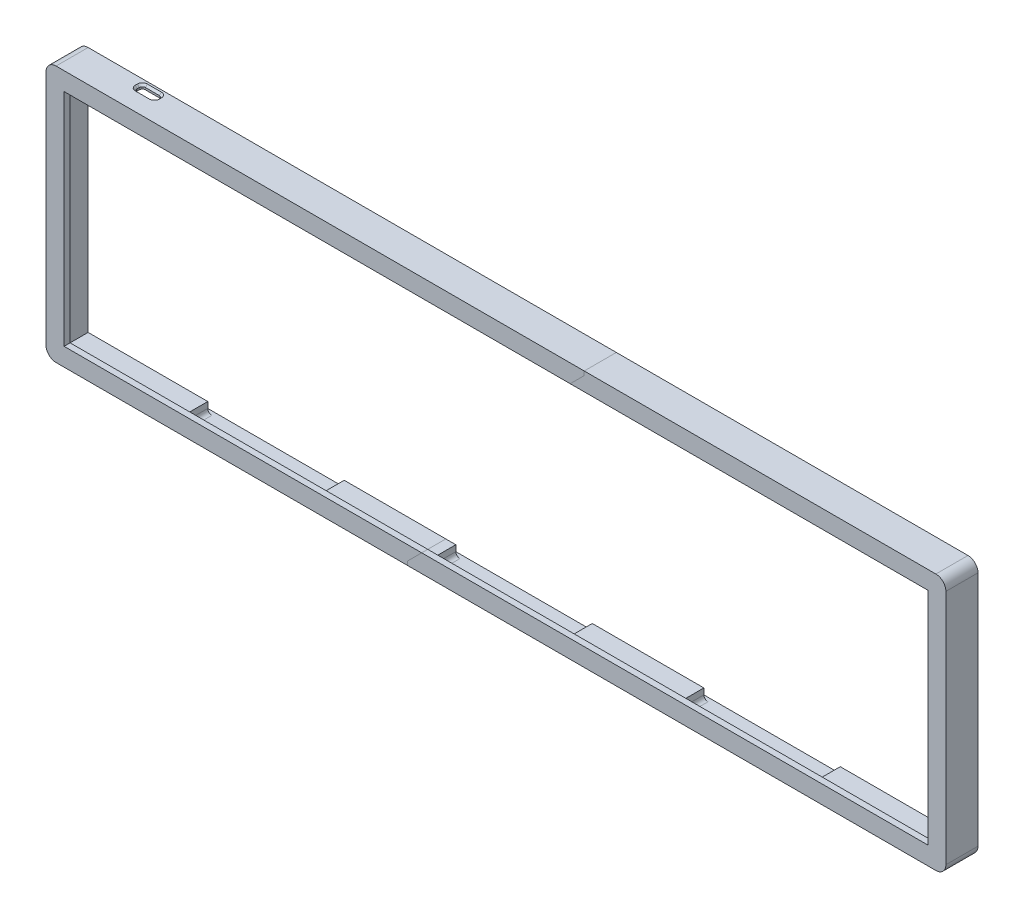
from build123d import *

# Parameters (mm, degrees)
BOSS_EXTRUDE1_DEPTH = 16
SKETCH2_W           = 438.581
SKETCH2_H           = 128
SKETCH2_W_2         = 430.581
SKETCH2_H_2         = 110
BOSS_EXTRUDE2_DEPTH = 3
SKETCH3_W           = 440.5822769
SKETCH3_H           = 124
CUT_EXTRUDE1_DEPTH  = 2
SKETCH4_R           = 1.05
CUT_EXTRUDE2_DEPTH  = 2.5
SKETCH5_W           = 30
SKETCH5_H           = 5
CUT_EXTRUDE3_DEPTH  = 6
CUT_EXTRUDE4_DEPTH  = 4
CHAMFER8_SIZE       = 1
SPLIT1_DEPTH        = 16
SPLIT1_START        = 2
SPLIT1_2_OUTLINE_R  = 1.05
SPLIT1_2_DEPTH      = 14
SPLIT1_START_2      = 13
SPLIT1_3_OUTLINE_R  = 1.05
SPLIT1_3_DEPTH      = 3
SPLIT1_4_DEPTH      = 3.5
SPLIT1_START_3      = 8
SPLIT1_5_OUTLINE_R  = 1.05
SPLIT1_5_DEPTH      = 5
SPLIT1_START_4      = 4.5
SPLIT1_6_OUTLINE_R  = 1.05
SPLIT1_6_DEPTH      = 3.5
SPLIT1_START_5      = 118
SPLIT1_7_DEPTH      = 4


with BuildPart() as part:
    # Sketch1 → Boss-Extrude1 (new body)
    with BuildSketch(Plane.XY):
        with BuildLine():
            ThreePointArc((-7, -2), (-5.535533906, -5.535533906), (-2, -7))
            Line((-2, -7), (436.581, -7))
            ThreePointArc((436.581, -7), (440.116533906, -5.535533906), (441.581, -2))
            Line((441.581, -2), (441.581, 116))
            ThreePointArc((441.581, 116), (440.116533906, 119.535533906), (436.581, 121))
            Line((436.581, 121), (-2, 121))
            ThreePointArc((-2, 121), (-5.535533906, 119.535533906), (-7, 116))
            Line((-7, 116), (-7, -2))
        make_face()
        with BuildLine():
            Line((251.291, 114), (306.936, 114))
            Line((306.936, 114), (306.936, 117))
            ThreePointArc((306.936, 117), (307.521786438, 118.414213562), (308.936, 119))
            Line((308.936, 119), (372.936, 119))
            ThreePointArc((372.936, 119), (374.350213562, 118.414213562), (374.936, 117))
            Line((374.936, 117), (374.936, 114))
            Line((374.936, 114), (434.581, 114))
            Line((434.581, 114), (434.581, 0))
            Line((434.581, 0), (374.936, 0))
            Line((374.936, 0), (374.936, -3))
            ThreePointArc((374.936, -3), (374.350213562, -4.414213562), (372.936, -5))
            Line((372.936, -5), (308.936, -5))
            ThreePointArc((308.936, -5), (307.521786438, -4.414213562), (306.936, -3))
            Line((306.936, -3), (306.936, 0))
            Line((306.936, 0), (251.291, 0))
            Line((251.291, 0), (251.291, -3))
            ThreePointArc((251.291, -3), (250.705213562, -4.414213562), (249.291, -5))
            Line((249.291, -5), (185.291, -5))
            ThreePointArc((185.291, -5), (183.876786438, -4.414213562), (183.291, -3))
            Line((183.291, -3), (183.291, 0))
            Line((183.291, 0), (127.646, 0))
            Line((127.646, 0), (127.646, -3))
            ThreePointArc((127.646, -3), (127.060213562, -4.414213562), (125.646, -5))
            Line((125.646, -5), (61.646, -5))
            ThreePointArc((61.646, -5), (60.231786438, -4.414213562), (59.646, -3))
            Line((59.646, -3), (59.646, 0))
            Line((59.646, 0), (0, 0))
            Line((0, 0), (0, 114))
            Line((0, 114), (59.646, 114))
            Line((59.646, 114), (59.646, 117))
            ThreePointArc((59.646, 117), (60.231786438, 118.414213562), (61.646, 119))
            Line((61.646, 119), (125.646, 119))
            ThreePointArc((125.646, 119), (127.060213562, 118.414213562), (127.646, 117))
            Line((127.646, 117), (127.646, 114))
            Line((127.646, 114), (183.291, 114))
            Line((183.291, 114), (183.291, 117))
            ThreePointArc((183.291, 117), (183.876786438, 118.414213562), (185.291, 119))
            Line((185.291, 119), (249.291, 119))
            ThreePointArc((249.291, 119), (250.705213562, 118.414213562), (251.291, 117))
            Line((251.291, 117), (251.291, 114))
        make_face(mode=Mode.SUBTRACT)
    extrude(amount=BOSS_EXTRUDE1_DEPTH)

    # Sketch2 → Boss-Extrude2 (add)
    with BuildSketch(Plane.XY.offset(16)):
        with Locations((217.2905, 57)):
            Rectangle(SKETCH2_W, SKETCH2_H)
        with Locations((217.2905, 57)):
            Rectangle(SKETCH2_W_2, SKETCH2_H_2, mode=Mode.SUBTRACT)
    extrude(amount=-BOSS_EXTRUDE2_DEPTH)

    # Sketch3 → Cut-Extrude1 (cut)
    with BuildSketch(Plane(origin=(0, 0, 0), x_dir=(-1, 0, 0), z_dir=(0, 0, -1))):
        with Locations((-217.28986155, 57)):
            Rectangle(SKETCH3_W, SKETCH3_H)
    extrude(amount=-CUT_EXTRUDE1_DEPTH, mode=Mode.SUBTRACT)

    # Sketch4 → Cut-Extrude2 (cut)
    with BuildSketch(Plane(origin=(0, 0, 2), x_dir=(-1, 0, 0), z_dir=(0, 0, -1))):
        with Locations((-279.1135, 116.5)):
            Circle(SKETCH4_R)
        with Locations((-155.4685, 116.5)):
            Circle(SKETCH4_R)
        with Locations((-279.1135, -2.5)):
            Circle(SKETCH4_R)
        with Locations((-155.4685, -2.5)):
            Circle(SKETCH4_R)
        with Locations((-2, -2.5)):
            Circle(SKETCH4_R)
        with Locations((-2, 116.5)):
            Circle(SKETCH4_R)
        with Locations((-432.581, 116.5)):
            Circle(SKETCH4_R)
        with Locations((-432.581, -2.5)):
            Circle(SKETCH4_R)
    extrude(amount=-CUT_EXTRUDE2_DEPTH, mode=Mode.SUBTRACT)

    # Sketch5 → Cut-Extrude3 (cut)
    with BuildSketch(Plane(origin=(0, 0, 2), x_dir=(-1, 0, 0), z_dir=(0, 0, -1))):
        with Locations((-32, 116.5)):
            Rectangle(SKETCH5_W, SKETCH5_H)
    extrude(amount=-CUT_EXTRUDE3_DEPTH, mode=Mode.SUBTRACT)

    # Sketch6 → Cut-Extrude4 (cut)
    with BuildSketch(Plane.XZ.offset(-119)):
        with BuildLine():
            Line((35.52, 2), (28.52, 2))
            ThreePointArc((28.52, 2), (27.459339828, 2.439339828), (27.02, 3.5))
            Line((27.02, 3.5), (27.02, 4.5))
            ThreePointArc((27.02, 4.5), (27.459339828, 5.560660172), (28.52, 6))
            Line((28.52, 6), (35.52, 6))
            ThreePointArc((35.52, 6), (36.580660172, 5.560660172), (37.02, 4.5))
            Line((37.02, 4.5), (37.02, 3.5))
            ThreePointArc((37.02, 3.5), (36.580660172, 2.439339828), (35.52, 2))
        make_face()
    extrude(amount=-CUT_EXTRUDE4_DEPTH, mode=Mode.SUBTRACT)

    # Chamfer8
    chamfer8_edges = [part.edges().sort_by_distance(p)[0] for p in [
        (32.02, 121, 6),
        (27.459339828, 121, 5.560660172),
        (27.02, 121, 4),
        (27.459339828, 121, 2.439339828),
        (32.02, 121, 2),
        (36.580660172, 121, 2.439339828),
        (37.02, 121, 4),
        (36.580660172, 121, 5.560660172),
    ]]
    chamfer(chamfer8_edges, length=CHAMFER8_SIZE)

    # Split1: read off the stored shape, not the designer's step
    # Split1 outline → Split1 (cut)
    with BuildSketch(Plane.XY):
        with BuildLine():
            Line((261.291, 121), (-2, 121))
            ThreePointArc((-2, 121), (-5.535533906, 119.535533906), (-7, 116))
            Line((-7, 116), (-7, -2))
            ThreePointArc((-7, -2), (-5.535533906, -5.535533906), (-2, -7))
            Line((-2, -7), (173.291, -7))
            Line((173.291, -7), (173.291, -5))
            Line((173.291, -5), (180.291, 2))
            Line((180.291, 2), (2, 2))
            Line((2, 2), (2, 112))
            Line((2, 112), (254.291, 112))
            Line((254.291, 112), (261.291, 119))
            Line((261.291, 119), (261.291, 121))
        make_face()
    extrude(amount=SPLIT1_DEPTH, mode=Mode.SUBTRACT)


with BuildPart() as body_2:
    # Split1 2 outline → Split1 2 (new body)
    # profile 1 of 2: a face of its own
    with BuildSketch(Plane.XY.offset(SPLIT1_START)):
        with BuildLine():
            ThreePointArc((127.646, -3), (127.060213562, -4.414213562), (125.646, -5))
            Line((125.646, -5), (61.646, -5))
            ThreePointArc((61.646, -5), (60.231786438, -4.414213562), (59.646, -3))
            Line((59.646, -3), (59.646, 0))
            Line((59.646, 0), (0, 0))
            Line((0, 0), (0, 114))
            Line((0, 114), (17, 114))
            Line((17, 114), (17, 119))
            Line((17, 119), (27.02, 119))
            Line((27.02, 119), (27.02, 120))
            Line((27.02, 120), (26.02, 121))
            Line((26.02, 121), (-2, 121))
            ThreePointArc((-2, 121), (-5.535533906, 119.535533906), (-7, 116))
            Line((-7, 116), (-7, -2))
            ThreePointArc((-7, -2), (-5.535533906, -5.535533906), (-2, -7))
            Line((-2, -7), (173.291, -7))
            Line((173.291, -7), (173.291, -5))
            Line((173.291, -5), (178.291, 0))
            Line((178.291, 0), (127.646, 0))
            Line((127.646, 0), (127.646, -3))
        make_face()
        with Locations((155.4685, -2.5)):
            Circle(SPLIT1_2_OUTLINE_R, mode=Mode.SUBTRACT)
        with Locations((2, -2.5)):
            Circle(SPLIT1_2_OUTLINE_R, mode=Mode.SUBTRACT)
        with Locations((2, 116.5)):
            Circle(SPLIT1_2_OUTLINE_R, mode=Mode.SUBTRACT)
    # profile 2 of 2: a face of its own
    with BuildSketch(Plane.XY.offset(SPLIT1_START)):
        with BuildLine():
            Line((251.291, 114), (256.291, 114))
            Line((256.291, 114), (261.291, 119))
            Line((261.291, 119), (261.291, 121))
            Line((261.291, 121), (38.02, 121))
            Line((38.02, 121), (37.02, 120))
            Line((37.02, 120), (37.02, 119))
            Line((37.02, 119), (47, 119))
            Line((47, 119), (47, 114))
            Line((47, 114), (59.646, 114))
            Line((59.646, 114), (59.646, 117))
            ThreePointArc((59.646, 117), (60.231786438, 118.414213562), (61.646, 119))
            Line((61.646, 119), (125.646, 119))
            ThreePointArc((125.646, 119), (127.060213562, 118.414213562), (127.646, 117))
            Line((127.646, 117), (127.646, 114))
            Line((127.646, 114), (183.291, 114))
            Line((183.291, 114), (183.291, 117))
            ThreePointArc((183.291, 117), (183.876786438, 118.414213562), (185.291, 119))
            Line((185.291, 119), (249.291, 119))
            ThreePointArc((249.291, 119), (250.705213562, 118.414213562), (251.291, 117))
            Line((251.291, 117), (251.291, 114))
        make_face()
        with Locations((155.4685, 116.5)):
            Circle(SPLIT1_2_OUTLINE_R, mode=Mode.SUBTRACT)
    extrude(amount=SPLIT1_2_DEPTH)

    # Split1 3 outline → Split1 3 (add)
    with BuildSketch(Plane.XY.offset(SPLIT1_START_2)):
        with BuildLine():
            Line((127.646, 0), (178.291, 0))
            Line((178.291, 0), (180.291, 2))
            Line((180.291, 2), (2, 2))
            Line((2, 2), (2, 112))
            Line((2, 112), (254.291, 112))
            Line((254.291, 112), (256.291, 114))
            Line((256.291, 114), (251.291, 114))
            Line((251.291, 114), (251.291, 117))
            ThreePointArc((251.291, 117), (250.705213562, 118.414213562), (249.291, 119))
            Line((249.291, 119), (185.291, 119))
            ThreePointArc((185.291, 119), (183.876786438, 118.414213562), (183.291, 117))
            Line((183.291, 117), (183.291, 114))
            Line((183.291, 114), (127.646, 114))
            Line((127.646, 114), (127.646, 117))
            ThreePointArc((127.646, 117), (127.060213562, 118.414213562), (125.646, 119))
            Line((125.646, 119), (61.646, 119))
            ThreePointArc((61.646, 119), (60.231786438, 118.414213562), (59.646, 117))
            Line((59.646, 117), (59.646, 114))
            Line((59.646, 114), (47, 114))
            Line((47, 114), (47, 119))
            Line((47, 119), (37.02, 119))
            Line((37.02, 119), (37.02, 120))
            Line((37.02, 120), (38.02, 121))
            Line((38.02, 121), (26.02, 121))
            Line((26.02, 121), (27.02, 120))
            Line((27.02, 120), (27.02, 119))
            Line((27.02, 119), (17, 119))
            Line((17, 119), (17, 114))
            Line((17, 114), (0, 114))
            Line((0, 114), (0, 0))
            Line((0, 0), (59.646, 0))
            Line((59.646, 0), (59.646, -3))
            ThreePointArc((59.646, -3), (60.231786438, -4.414213562), (61.646, -5))
            Line((61.646, -5), (125.646, -5))
            ThreePointArc((125.646, -5), (127.060213562, -4.414213562), (127.646, -3))
            Line((127.646, -3), (127.646, 0))
        make_face()
        with Locations((155.4685, 116.5)):
            Circle(SPLIT1_3_OUTLINE_R)
        with Locations((2, 116.5)):
            Circle(SPLIT1_3_OUTLINE_R)
        with Locations((2, -2.5)):
            Circle(SPLIT1_3_OUTLINE_R)
        with Locations((155.4685, -2.5)):
            Circle(SPLIT1_3_OUTLINE_R)
    extrude(amount=SPLIT1_3_DEPTH)

    # Split1 4 outline → Split1 4 (add)
    with BuildSketch(Plane.XY):
        with BuildLine():
            Line((173.291, -7), (173.291, -5))
            Line((173.291, -5), (-3.0012769, -5))
            Line((-3.0012769, -5), (-3.0012769, 119))
            Line((-3.0012769, 119), (261.291, 119))
            Line((261.291, 119), (261.291, 121))
            Line((261.291, 121), (-2, 121))
            ThreePointArc((-2, 121), (-5.535533906, 119.535533906), (-7, 116))
            Line((-7, 116), (-7, -2))
            ThreePointArc((-7, -2), (-5.535533906, -5.535533906), (-2, -7))
            Line((-2, -7), (173.291, -7))
        make_face()
    extrude(amount=SPLIT1_4_DEPTH)

    # Split1 5 outline → Split1 5 (add)
    with BuildSketch(Plane.XY.offset(SPLIT1_START_3)):
        Polygon((27.02, 119), (17, 119), (17, 114), (47, 114), (47, 119), (37.02, 119), (37.02, 120), (38.02, 121), (26.02, 121), (27.02, 120), align=None)
        with Locations((155.4685, 116.5)):
            Circle(SPLIT1_5_OUTLINE_R)
        with Locations((2, 116.5)):
            Circle(SPLIT1_5_OUTLINE_R)
        with Locations((2, -2.5)):
            Circle(SPLIT1_5_OUTLINE_R)
        with Locations((155.4685, -2.5)):
            Circle(SPLIT1_5_OUTLINE_R)
    extrude(amount=SPLIT1_5_DEPTH)

    # Split1 6 outline → Split1 6 (add)
    with BuildSketch(Plane.XY.offset(SPLIT1_START_4)):
        Polygon((38.02, 121), (26.02, 121), (27.02, 120), (27.02, 119), (37.02, 119), (37.02, 120), align=None)
        with Locations((155.4685, 116.5)):
            Circle(SPLIT1_6_OUTLINE_R)
        with Locations((2, 116.5)):
            Circle(SPLIT1_6_OUTLINE_R)
        with Locations((2, -2.5)):
            Circle(SPLIT1_6_OUTLINE_R)
        with Locations((155.4685, -2.5)):
            Circle(SPLIT1_6_OUTLINE_R)
    extrude(amount=SPLIT1_6_DEPTH)

    # Split1 7 outline → Split1 7 (cut)
    with BuildSketch(Plane(origin=(0, 0, 0), x_dir=(1, 0, 0), z_dir=(0, 1, 0)).offset(SPLIT1_START_5)):
        with BuildLine():
            ThreePointArc((27.02, -4.5), (27.459339828, -5.560660172), (28.52, -6))
            Line((28.52, -6), (35.52, -6))
            ThreePointArc((35.52, -6), (36.580660172, -5.560660172), (37.02, -4.5))
            Line((37.02, -4.5), (27.02, -4.5))
        make_face()
        with BuildLine():
            ThreePointArc((28.52, -2), (27.459339828, -2.439339828), (27.02, -3.5))
            Line((27.02, -3.5), (37.02, -3.5))
            ThreePointArc((37.02, -3.5), (36.580660172, -2.439339828), (35.52, -2))
            Line((35.52, -2), (28.52, -2))
        make_face()
    extrude(amount=SPLIT1_7_DEPTH, mode=Mode.SUBTRACT)

    # Split1 8: loft between two sections, ruled curve by curve
    split1_8_from = [
        Edge.make_three_point_arc((27.02, 120, 4.5), (27.459339828, 120, 5.560660172), (28.52, 120, 6)),
        Edge.make_three_point_arc((35.52, 120, 6), (36.580660172, 120, 5.560660172), (37.02, 120, 4.5)),
        Edge.make_line((28.52, 120, 6), (35.52, 120, 6)),
        Edge.make_line((37.02, 120, 4.5), (27.02, 120, 4.5)),
    ]
    split1_8_to = [
        Edge.make_three_point_arc((26.02, 121, 4.5), (26.752233047, 121, 6.267766953), (28.52, 121, 7)),
        Edge.make_three_point_arc((35.52, 121, 7), (37.287766953, 121, 6.267766953), (38.02, 121, 4.5)),
        Edge.make_line((28.52, 121, 7), (35.52, 121, 7)),
        Edge.make_line((38.02, 121, 4.5), (26.02, 121, 4.5)),
    ]
    split1_8 = Solid(Shell([*[Face.make_surface_from_curves(split1_8_from[k], split1_8_to[k]) for k in range(4)], Face(Wire(split1_8_from)), Face(Wire(split1_8_to))]))
    add(split1_8, mode=Mode.SUBTRACT)

    # Split1 9: loft between two sections, ruled curve by curve
    split1_9_from = [
        Edge.make_three_point_arc((37.02, 120, 3.5), (36.580660172, 120, 2.439339828), (35.52, 120, 2)),
        Edge.make_three_point_arc((28.52, 120, 2), (27.459339828, 120, 2.439339828), (27.02, 120, 3.5)),
        Edge.make_line((35.52, 120, 2), (28.52, 120, 2)),
        Edge.make_line((27.02, 120, 3.5), (37.02, 120, 3.5)),
    ]
    split1_9_to = [
        Edge.make_three_point_arc((38.02, 121, 3.5), (37.287766953, 121, 1.732233047), (35.52, 121, 1)),
        Edge.make_three_point_arc((28.52, 121, 1), (26.752233047, 121, 1.732233047), (26.02, 121, 3.5)),
        Edge.make_line((35.52, 121, 1), (28.52, 121, 1)),
        Edge.make_line((26.02, 121, 3.5), (38.02, 121, 3.5)),
    ]
    split1_9 = Solid(Shell([*[Face.make_surface_from_curves(split1_9_from[k], split1_9_to[k]) for k in range(4)], Face(Wire(split1_9_from)), Face(Wire(split1_9_to))]))
    add(split1_9, mode=Mode.SUBTRACT)


solid = Compound([part.part, body_2.part])
